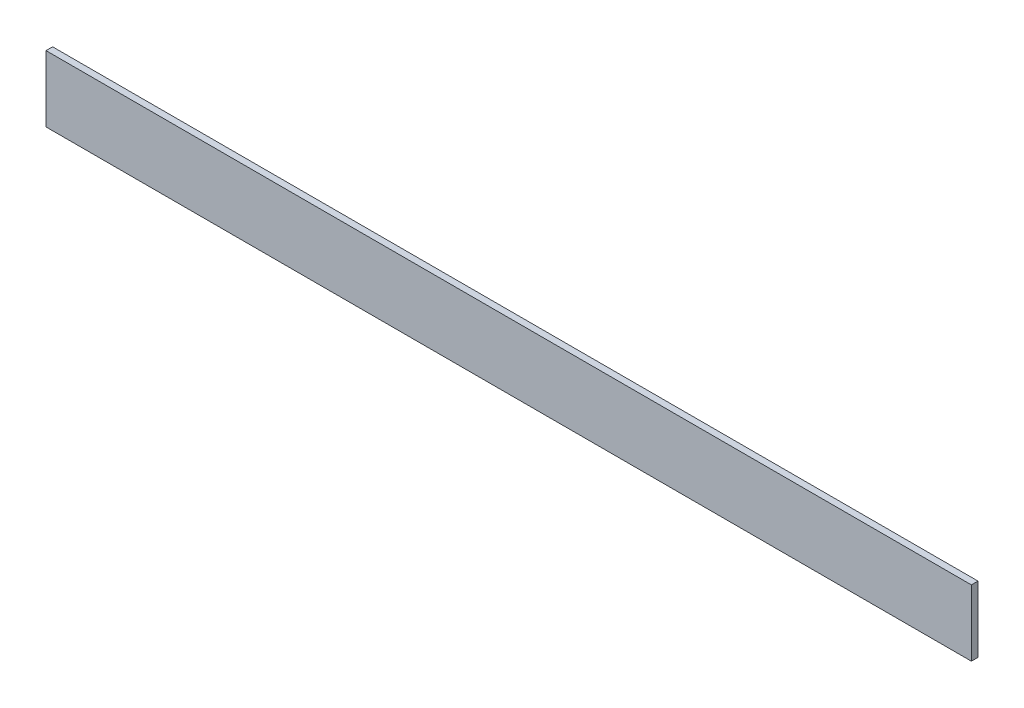
from build123d import *

# Parameters (mm, degrees)
IZIM1_W            = 1400
IZIM1_H            = 100
TABAN_FLAN_1_DEPTH = 10


# Sheet-metal steps are written as plain solids
with BuildPart() as part:
    # Çizim1 → Taban-Flanş1 (new body)
    with BuildSketch(Plane.XY):
        with Locations((700, -50)):
            Rectangle(IZIM1_W, IZIM1_H)
    extrude(amount=-TABAN_FLAN_1_DEPTH)


solid = part.part
